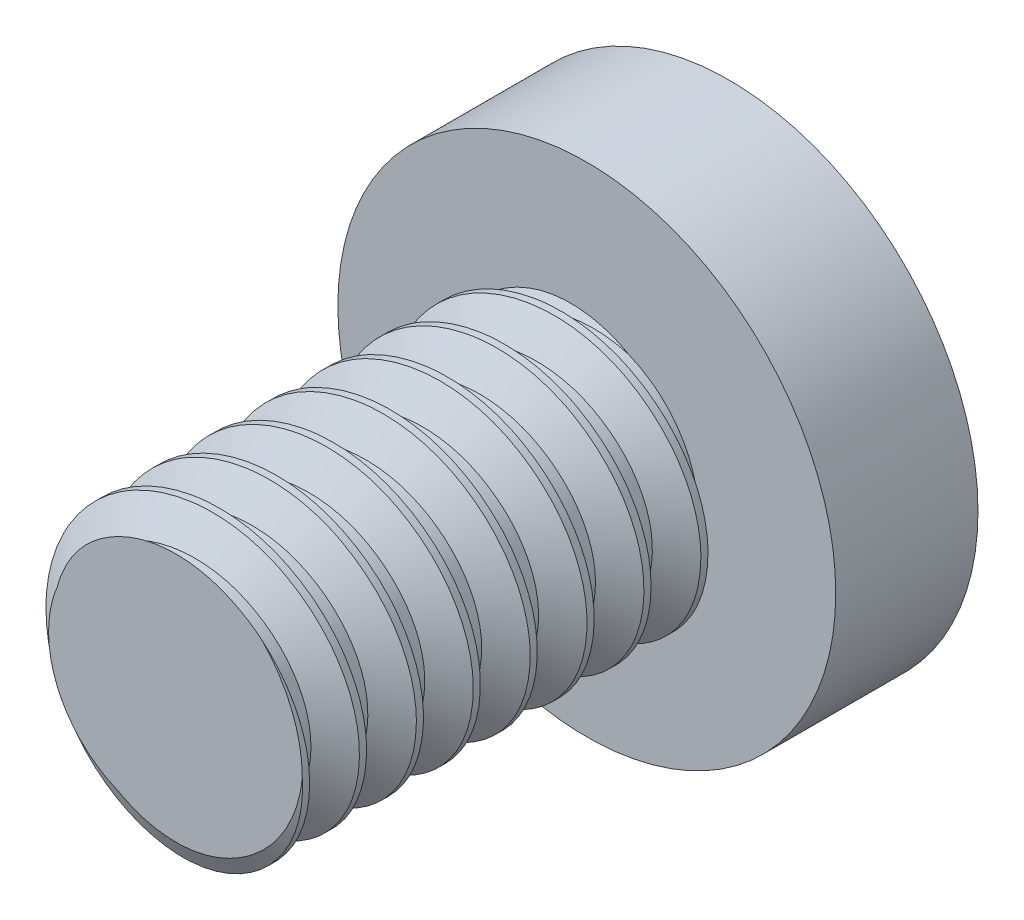
from build123d import *

# Parameters (mm, degrees)
SKETCH_1_R      = 1.75
EXTRUDE_1_DEPTH = 0.8
SKETCH_2_R      = 1.75
EXTRUDE_2_DEPTH = 0.2
SKETCH_3_R      = 1
EXTRUDE_3_DEPTH = 3
THREAD_3_PITCH  = 0.4
THREAD_3_FROM   = 1


with BuildPart() as part:
    # 草图1 → 凸台-拉伸1 (new body)
    with BuildSketch(Plane.XY):
        Circle(SKETCH_1_R)
        Polygon((0.431939083, 0.750618831), (-0.434085434, 0.749379634), (-0.866024517, -0.001239197), (-0.431939083, -0.750618831), (0.434085434, -0.749379634), (0.866024517, 0.001239197), align=None, mode=Mode.SUBTRACT)
    extrude(amount=EXTRUDE_1_DEPTH)

    # Sketch 2 → 凸台-拉伸2 (add)
    with BuildSketch(Plane.XY.offset(0.8)):
        Circle(SKETCH_2_R)
    extrude(amount=EXTRUDE_2_DEPTH)

    # 草图3 → 凸台-拉伸3 (add)
    with BuildSketch(Plane.XY.offset(1)):
        Circle(SKETCH_3_R)
    extrude(amount=EXTRUDE_3_DEPTH)

    # 螺纹线3: arcs per turn and ends read off the stored shape
    # 螺纹线3: the profile of Sketch 2 2 profile screwed along a right-hand helix through 25 turns, 6 arcs to a turn; built about Z, then put on its axis
    thread_3_z = Axis((0, 0, 0), (0, 0, 1))
    thread_3_corners = [(1.0003, 0, -0.000173205), (1.0003, 0, 0.350173204), (0.78349365, 0, 0.224999999), (0.78349365, 0, 0.124999999)]
    with BuildLine(mode=Mode.PRIVATE) as thread_3_profile:
        Line(thread_3_corners[0], thread_3_corners[1])
        Line(thread_3_corners[1], thread_3_corners[2])
        Line(thread_3_corners[2], thread_3_corners[3])
        Line(thread_3_corners[3], thread_3_corners[0])
    thread_3_cap = Face(thread_3_profile.wire())
    thread_3_turn_angles = [0, 30, 60, 90, 120, 150, 180, 210, 240, 270, 300, 330, 360]
    thread_3_turn_weights = [1, 0.8660254037844387, 1, 0.8660254037844387, 1, 0.8660254037844387, 1, 0.8660254037844387, 1, 0.8660254037844387, 1, 0.8660254037844387, 1]
    thread_3_turn_rails = [Edge.make_bspline([Vector(p[0], p[1], 0).rotate(thread_3_z, thread_3_turn_angles[k]) / thread_3_turn_weights[k] + Vector(0, 0, p[2] + THREAD_3_PITCH * thread_3_turn_angles[k] / 360) for k in range(13)], [0, 0, 0, 1, 1, 2, 2, 3, 3, 4, 4, 5, 5, 6, 6, 6], 2, thread_3_turn_weights) for p in thread_3_corners]
    thread_3_turn_sides = [Face.make_surface_from_curves(thread_3_turn_rails[p[0]], thread_3_turn_rails[p[1]]) for p in [(0, 1), (1, 2), (2, 3), (3, 0)]]
    thread_3 = Plane(origin=(0, 0, 0), x_dir=(1, 0, 0), z_dir=(0, 0, 1)) * split(Solid(Shell([*[p.moved(Location((0, 0, THREAD_3_PITCH * i))) for i in range(25) for p in thread_3_turn_sides], thread_3_cap, thread_3_cap.rotate(thread_3_z, 9000).moved(Location((0, 0, THREAD_3_PITCH * 9000 / 360)))])), bisect_by=Plane.XY.offset(THREAD_3_FROM), keep=Keep.TOP, mode=Mode.PRIVATE)
    add(thread_3, mode=Mode.SUBTRACT)


solid = part.part
